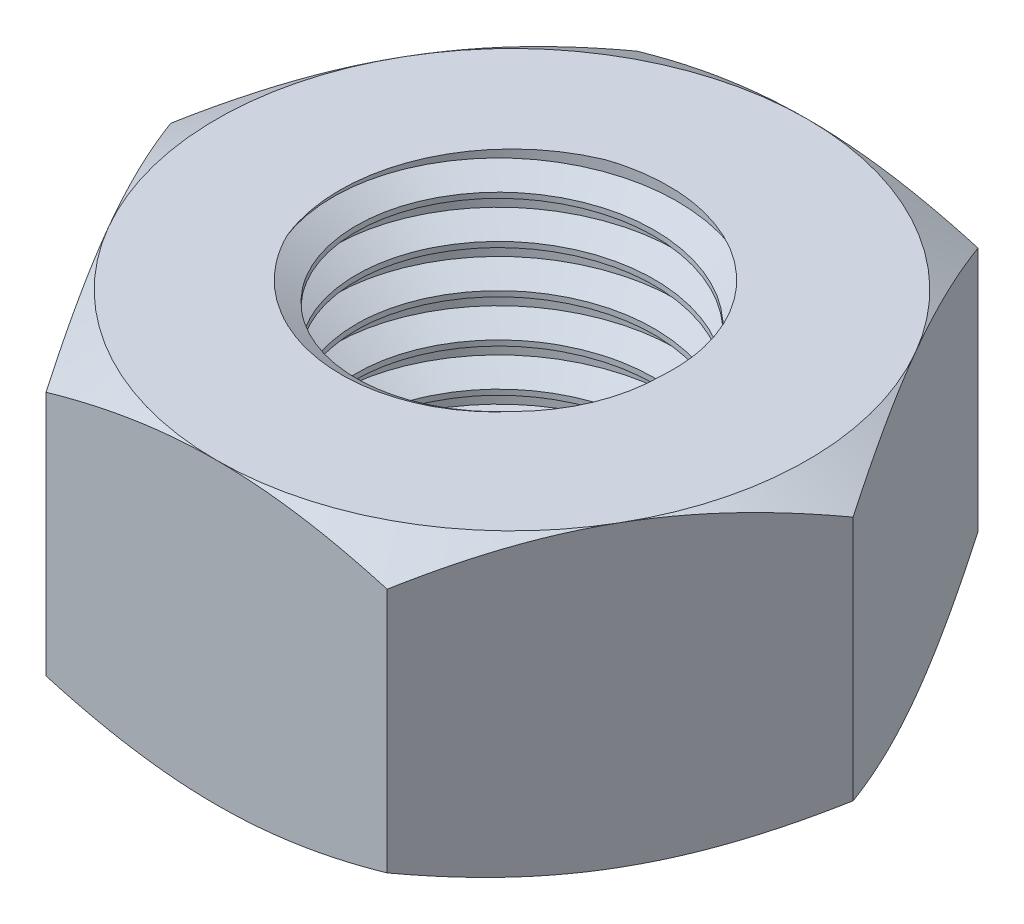
from build123d import *

# Parameters (mm, degrees)
BOSS_EXTRUDE1_DEPTH    = 7
M16X2_0_TAPPED_HOLE1_D = 14
THREAD1_PITCH          = 2


with BuildPart() as part:
    # Sketch1 → Boss-Extrude1 (new, symmetric)
    with BuildSketch(Plane(origin=(0, 0, 0), x_dir=(1, 0, 0), z_dir=(0, 1, 0))):
        Polygon((16, 0), (8, 13.856406461), (-8, 13.856406461), (-16, 0), (-8, -13.856406461), (8, -13.856406461), align=None)
    extrude(amount=BOSS_EXTRUDE1_DEPTH, both=True)

    # M16x2.0 Tapped Hole1 (through all)
    with Locations(Plane(origin=(0, 7, 0), x_dir=(1, 0, 0), z_dir=(0, 1, 0))):
        with Locations((0, 0)):
            Hole(M16X2_0_TAPPED_HOLE1_D / 2)

    # Thread1: the profile of Thread Profile1 profile screwed along a right-hand helix of 10 turns, 10 arcs to a turn; built about Z, then put on its axis
    thread1_z = Axis((0, 0, 0), (0, 0, 1))
    thread1_corners = [(6.9997, 0, -0.000173205), (6.9997, 0, 1.7501732), (8.08253175, 0, 1.124999997), (8.08253175, 0, 0.624999997)]
    with BuildLine(mode=Mode.PRIVATE) as thread1_profile:
        Line(thread1_corners[0], thread1_corners[1])
        Line(thread1_corners[1], thread1_corners[2])
        Line(thread1_corners[2], thread1_corners[3])
        Line(thread1_corners[3], thread1_corners[0])
    thread1_cap = Face(thread1_profile.wire())
    thread1_turn_angles = [0, 18, 36, 54, 72, 90, 108, 126, 144, 162, 180, 198, 216, 234, 252, 270, 288, 306, 324, 342, 360]
    thread1_turn_weights = [1, 0.9510565162951535, 1, 0.9510565162951535, 1, 0.9510565162951535, 1, 0.9510565162951535, 1, 0.9510565162951535, 1, 0.9510565162951535, 1, 0.9510565162951535, 1, 0.9510565162951535, 1, 0.9510565162951535, 1, 0.9510565162951535, 1]
    thread1_turn_rails = [Edge.make_bspline([Vector(p[0], p[1], 0).rotate(thread1_z, thread1_turn_angles[k]) / thread1_turn_weights[k] + Vector(0, 0, p[2] + THREAD1_PITCH * thread1_turn_angles[k] / 360) for k in range(21)], [0, 0, 0, 1, 1, 2, 2, 3, 3, 4, 4, 5, 5, 6, 6, 7, 7, 8, 8, 9, 9, 10, 10, 10], 2, thread1_turn_weights) for p in thread1_corners]
    thread1_turn_sides = [Face.make_surface_from_curves(thread1_turn_rails[p[0]], thread1_turn_rails[p[1]]) for p in [(0, 1), (1, 2), (2, 3), (3, 0)]]
    thread1 = Plane(origin=(0, 10, 0), x_dir=(-1, 0, 0), z_dir=(0, -1, 0)) * Solid(Shell([*[p.moved(Location((0, 0, THREAD1_PITCH * i))) for i in range(10) for p in thread1_turn_sides], thread1_cap, thread1_cap.rotate(thread1_z, 3600).moved(Location((0, 0, THREAD1_PITCH * 3600 / 360)))]))
    add(thread1, mode=Mode.SUBTRACT)

    # Sketch7 → Cut-Revolve1 (revolve, cut)
    with BuildSketch(Plane(origin=(0, 0, 0), x_dir=(0, 0, -1), z_dir=(1, 0, 0))):
        Polygon((13.856406461, 7), (22.088270014, 7), (22.088270014, 2.247331361), align=None)
    cut_revolve1 = revolve(axis=Axis((0, 0, 0), (0, 1, 0)), mode=Mode.SUBTRACT)

    # Mirror1: Cut-Revolve1 across plane
    add(cut_revolve1.mirror(Plane.ZX), mode=Mode.SUBTRACT)


solid = part.part
